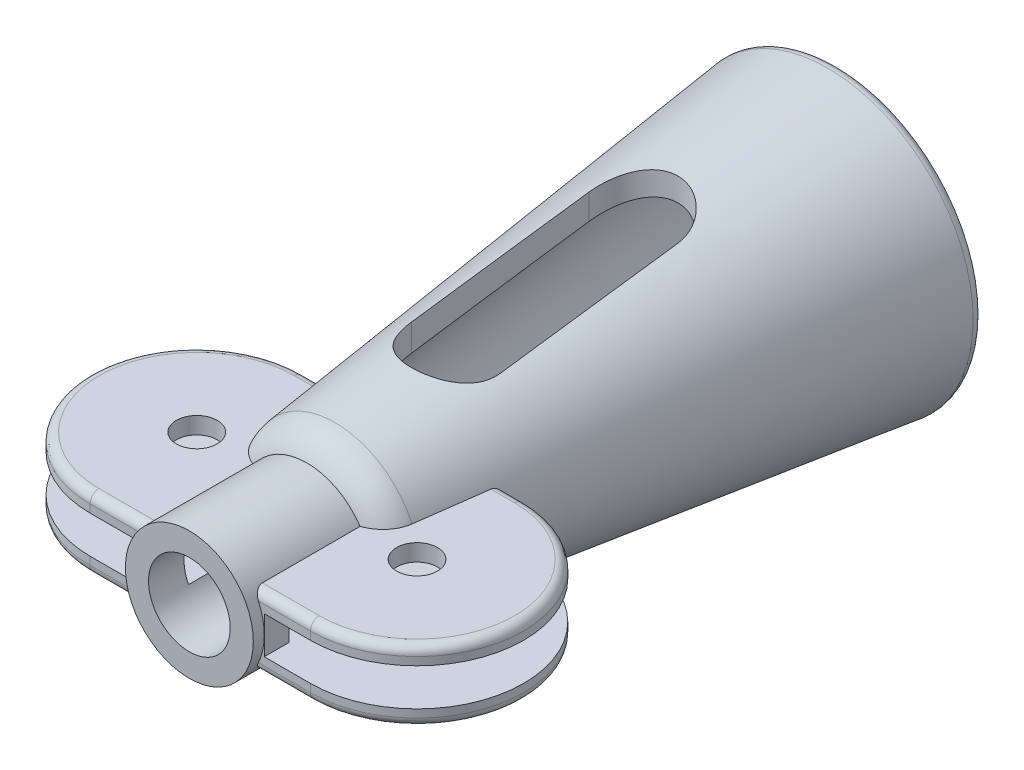
from build123d import *

# Parameters (mm, degrees)
SKETCH1_R               = 20.955
BOSS_EXTRUDE1_DEPTH     = 76.2
BOSS_EXTRUDE1_TAPER     = 7
SHELL4_T                = -3.302
FILLET2_R               = 5.08
BOSS_EXTRUDE2_START     = 59.69
BOSS_EXTRUDE2_OUTLINE_R = 9.144
BOSS_EXTRUDE2_DEPTH     = 33.02
SHELL5_START            = 59.69
SHELL5_OUTLINE_R        = 5.842
SHELL5_DEPTH            = 33.02
BOSS_EXTRUDE3_DEPTH     = 5.08
CUT_EXTRUDE1_DEPTH      = 2.667
SKETCH5_R               = 5.842
CUT_EXTRUDE2_DEPTH      = 99.523078264
SKETCH6_R               = 2.921
CUT_EXTRUDE3_DEPTH      = 12.7
CUT_EXTRUDE4_DEPTH      = 19.05
FILLET3_R               = 1.27


# Read off the part's stored shape, not the designer's step: Boss-Extrude2, Shell5
with BuildPart() as part:
    # Sketch1 → Boss-Extrude1 (new body)
    with BuildSketch(Plane.XY):
        Circle(SKETCH1_R)
    extrude(amount=BOSS_EXTRUDE1_DEPTH, taper=BOSS_EXTRUDE1_TAPER)

    # Shell4
    shell4_openings = [part.faces().sort_by_distance(p)[0] for p in [
        (0, 0, 76.2),
        (0, 0, 0),
    ]]
    offset(amount=SHELL4_T, openings=shell4_openings, kind=Kind.INTERSECTION)

    # Fillet2
    # the kernel refuses this fillet: 5.08 mm, written as the material it takes off along each edge
    with BuildSketch(Plane(origin=(0, 0, 76.2), x_dir=(1, 0, 0), z_dir=(0, 1, 0))) as fillet2_piece_1:
        with BuildLine():
            CenterArc((7.087210198, 4.939901625), FILLET2_R, 283.487315115, 69.512684885)
            Line((8.272019016, 0), (8.295715192, -0.098798033))
            ThreePointArc((8.295715192, -0.098798033), (9.935417737, -0.1016), (11.598816459, -0.1016))
            Line((11.598816459, -0.1016), (11.699659148, -0.012381925))
            Line((11.699659148, -0.012381925), (12.230187337, 4.308423435))
            Line((12.230187337, 4.308423435), (12.129344648, 4.320805361))
        make_face()
    revolve(axis=Axis((0, 0, 76.2), (0, 0, -1)), mode=Mode.SUBTRACT)

    # Boss-Extrude2 outline → Boss-Extrude2 (add)
    with BuildSketch(Plane.XY.offset(BOSS_EXTRUDE2_START)):
        Circle(BOSS_EXTRUDE2_OUTLINE_R)
    extrude(amount=BOSS_EXTRUDE2_DEPTH)

    # Shell5 outline → Shell5 (cut)
    with BuildSketch(Plane.XY.offset(SHELL5_START)):
        Circle(SHELL5_OUTLINE_R)
    extrude(amount=SHELL5_DEPTH, mode=Mode.SUBTRACT)

    # Sketch2 → Boss-Extrude3 (add, symmetric)
    with BuildSketch(Plane(origin=(0, 0, 0), x_dir=(1, 0, 0), z_dir=(0, 1, 0))):
        with BuildLine():
            Line((-15.748, -60.665097375), (15.748, -60.665097375))
            ThreePointArc((15.748, -60.665097375), (30.988, -75.905097375), (15.748, -91.145097375))
            Line((15.748, -91.145097375), (-15.748, -91.145097375))
            ThreePointArc((-15.748, -91.145097375), (-30.988, -75.905097375), (-15.748, -60.665097375))
        make_face()
    extrude(amount=BOSS_EXTRUDE3_DEPTH, both=True)

    # Sketch4 → Cut-Extrude1 (cut, symmetric)
    with BuildSketch(Plane(origin=(0, 0, 0), x_dir=(1, 0, 0), z_dir=(0, 1, 0))):
        Polygon((-9.144, -87.63), (9.144, -87.63), (9.144, -92.71), (31.52363781, -92.71), (31.52363781, -60.665097375), (13.506262657, -60.665097375), (13.506262657, -63.205097375), (-13.506262657, -63.205097375), (-13.506262657, -60.665097375), (-31.52363781, -60.665097375), (-31.52363781, -92.71), (-9.144, -92.71), align=None)
    extrude(amount=CUT_EXTRUDE1_DEPTH, both=True, mode=Mode.SUBTRACT)

    # Sketch5 → Cut-Extrude2 (cut, through all)
    with BuildSketch(Plane.XY.offset(91.145097375)):
        Circle(SKETCH5_R)
    extrude(amount=-CUT_EXTRUDE2_DEPTH, mode=Mode.SUBTRACT)

    # Sketch6 → Cut-Extrude3 (cut, symmetric)
    with BuildSketch(Plane(origin=(0, 0, 0), x_dir=(1, 0, 0), z_dir=(0, 1, 0))):
        with Locations(Location((15.748, -75.905097375, 0), (0, 0, 270))):
            Circle(SKETCH6_R)
        with Locations(Location((-15.748, -75.905097375, 0), (0, 0, 270))):
            Circle(SKETCH6_R)
    extrude(amount=CUT_EXTRUDE3_DEPTH, both=True, mode=Mode.SUBTRACT)

    # Sketch7 → Cut-Extrude4 (cut, symmetric)
    with BuildSketch(Plane(origin=(0, 0, 0), x_dir=(1, 0, 0), z_dir=(0, 1, 0))):
        with BuildLine():
            Line((6.35, -29.21), (6.35, -54.61))
            ThreePointArc((6.35, -54.61), (0, -60.96), (-6.35, -54.61))
            Line((-6.35, -54.61), (-6.35, -29.21))
            ThreePointArc((-6.35, -29.21), (0, -22.86), (6.35, -29.21))
        make_face()
    extrude(amount=CUT_EXTRUDE4_DEPTH, both=True, mode=Mode.SUBTRACT)

    # Fillet3
    fillet3_edges = [part.edges().sort_by_distance(p)[0] for p in [
        (14.131250414, 5.08, 60.665097375),
        (11.675523905, 5.08, 91.145097375),
        (30.988, 5.08, 75.905097375),
        (14.131250414, -5.08, 60.665097375),
        (11.675523905, -5.08, 91.145097375),
        (30.988, -5.08, 75.905097375),
        (-14.131250414, -5.08, 60.665097375),
        (-11.675523905, -5.08, 91.145097375),
        (-30.988, -5.08, 75.905097375),
        (-14.131250414, 5.08, 60.665097375),
        (-11.675523905, 5.08, 91.145097375),
        (-30.988, 5.08, 75.905097375),
        (-20.955, 0, 0),
    ]]
    fillet(fillet3_edges, radius=FILLET3_R)


solid = part.part
